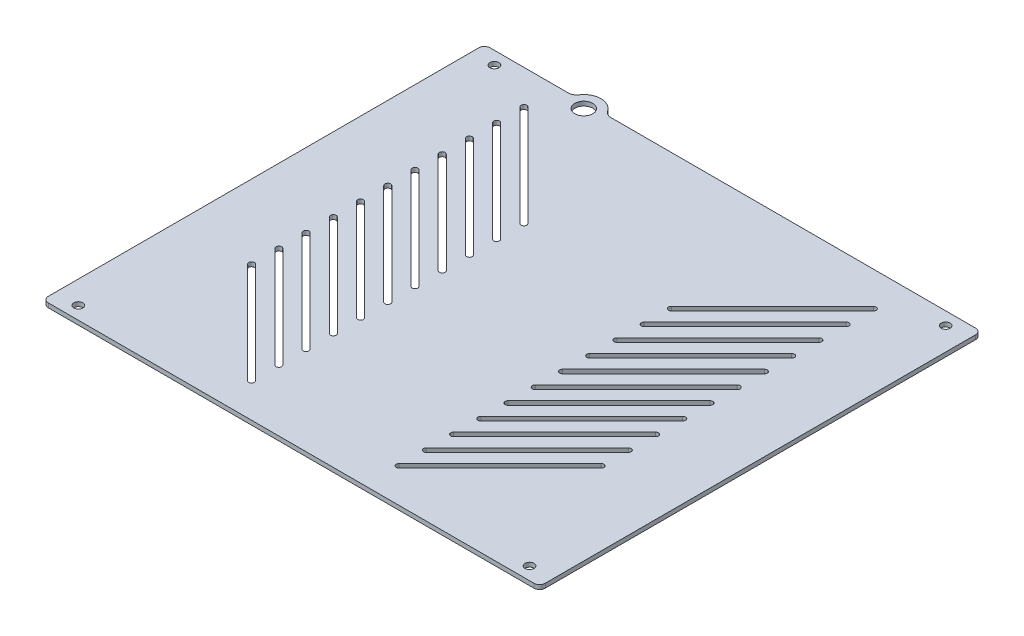
from build123d import *

# Parameters (mm, degrees)
SKETCH1_W          = 174
SKETCH1_H          = 154.7
SKETCH1_R          = 1.575
BASE_FLANGE1_DEPTH = 1.5
FILLET1_R          = 2
CUT_EXTRUDE1_DEPTH = 117.422817781
SKETCH7_R          = 6
TAB1_DEPTH         = 1.5
SKETCH10_R         = 3.15
CUT_EXTRUDE2_DEPTH = 120.117893282
FILLET2_R          = 3


# Sheet-metal steps are written as plain solids
with BuildPart() as part:
    # Sketch1 → Base-Flange1 (new body)
    with BuildSketch(Plane(origin=(0, 0, 0), x_dir=(1, 0, 0), z_dir=(0, 1, 0))):
        Rectangle(SKETCH1_W, SKETCH1_H)
        with Locations(Location((-79, 72.85, 0), (0, 0, 270))):
            Circle(SKETCH1_R, mode=Mode.SUBTRACT)
        with Locations(Location((79, 72.85, 0), (0, 0, 270))):
            Circle(SKETCH1_R, mode=Mode.SUBTRACT)
        with Locations(Location((79, -72.85, 0), (0, 0, 270))):
            Circle(SKETCH1_R, mode=Mode.SUBTRACT)
        with Locations(Location((-79, -72.85, 0), (0, 0, 270))):
            Circle(SKETCH1_R, mode=Mode.SUBTRACT)
    extrude(amount=-BASE_FLANGE1_DEPTH)

    # Fillet1
    fillet1_edges = [part.edges().sort_by_distance(p)[0] for p in [
        (-87, -0.75, -77.35),
        (87, -0.75, -77.35),
        (87, -0.75, 77.35),
        (-87, -0.75, 77.35),
    ]]
    fillet(fillet1_edges, radius=FILLET1_R)

    # Sketch6 → Cut-Extrude1 (cut, through all)
    with BuildSketch(Plane(origin=(0, 0, 0), x_dir=(1, 0, 0), z_dir=(0, 1, 0))):
        with BuildLine():
            Line((26.529437252, -66.057106781), (61.884776311, -30.701767722))
            ThreePointArc((61.884776311, -30.701767722), (61.884776311, -29.287554159), (60.470562748, -29.287554159))
            Line((60.470562748, -29.287554159), (25.115223689, -64.642893219))
            ThreePointArc((25.115223689, -64.642893219), (25.115223689, -66.057106781), (26.529437252, -66.057106781))
        make_face()
        with BuildLine():
            Line((26.529437252, -56.522640687), (61.884776311, -21.167301628))
            ThreePointArc((61.884776311, -21.167301628), (61.884776311, -19.753088065), (60.470562748, -19.753088065))
            Line((60.470562748, -19.753088065), (25.115223689, -55.108427125))
            ThreePointArc((25.115223689, -55.108427125), (25.115223689, -56.522640687), (26.529437252, -56.522640687))
        make_face()
        with BuildLine():
            Line((26.529437252, -46.988174593), (61.884776311, -11.632835534))
            ThreePointArc((61.884776311, -11.632835534), (61.884776311, -10.218621971), (60.470562748, -10.218621971))
            Line((60.470562748, -10.218621971), (25.115223689, -45.573961031))
            ThreePointArc((25.115223689, -45.573961031), (25.115223689, -46.988174593), (26.529437252, -46.988174593))
        make_face()
        with BuildLine():
            Line((26.529437252, -37.453708499), (61.884776311, -2.09836944))
            ThreePointArc((61.884776311, -2.09836944), (61.884776311, -0.684155877), (60.470562748, -0.684155877))
            Line((60.470562748, -0.684155877), (25.115223689, -36.039494937))
            ThreePointArc((25.115223689, -36.039494937), (25.115223689, -37.453708499), (26.529437252, -37.453708499))
        make_face()
        with BuildLine():
            Line((26.529437252, -27.919242405), (61.884776311, 7.436096654))
            ThreePointArc((61.884776311, 7.436096654), (61.884776311, 8.850310217), (60.470562748, 8.850310217))
            Line((60.470562748, 8.850310217), (25.115223689, -26.505028843))
            ThreePointArc((25.115223689, -26.505028843), (25.115223689, -27.919242405), (26.529437252, -27.919242405))
        make_face()
        with BuildLine():
            Line((26.529437252, -18.384776311), (61.884776311, 16.970562748))
            ThreePointArc((61.884776311, 16.970562748), (61.884776311, 18.384776311), (60.470562748, 18.384776311))
            Line((60.470562748, 18.384776311), (25.115223689, -16.970562748))
            ThreePointArc((25.115223689, -16.970562748), (25.115223689, -18.384776311), (26.529437252, -18.384776311))
        make_face()
        with BuildLine():
            Line((26.529437252, -8.850310217), (61.884776311, 26.505028843))
            ThreePointArc((61.884776311, 26.505028843), (61.884776311, 27.919242405), (60.470562748, 27.919242405))
            Line((60.470562748, 27.919242405), (25.115223689, -7.436096654))
            ThreePointArc((25.115223689, -7.436096654), (25.115223689, -8.850310217), (26.529437252, -8.850310217))
        make_face()
        with BuildLine():
            Line((26.529437252, 0.684155877), (61.884776311, 36.039494937))
            ThreePointArc((61.884776311, 36.039494937), (61.884776311, 37.453708499), (60.470562748, 37.453708499))
            Line((60.470562748, 37.453708499), (25.115223689, 2.09836944))
            ThreePointArc((25.115223689, 2.09836944), (25.115223689, 0.684155877), (26.529437252, 0.684155877))
        make_face()
        with BuildLine():
            Line((26.529437252, 10.218621971), (61.884776311, 45.573961031))
            ThreePointArc((61.884776311, 45.573961031), (61.884776311, 46.988174593), (60.470562748, 46.988174593))
            Line((60.470562748, 46.988174593), (25.115223689, 11.632835534))
            ThreePointArc((25.115223689, 11.632835534), (25.115223689, 10.218621971), (26.529437252, 10.218621971))
        make_face()
        with BuildLine():
            Line((26.529437252, 19.753088065), (61.884776311, 55.108427125))
            ThreePointArc((61.884776311, 55.108427125), (61.884776311, 56.522640687), (60.470562748, 56.522640687))
            Line((60.470562748, 56.522640687), (25.115223689, 21.167301628))
            ThreePointArc((25.115223689, 21.167301628), (25.115223689, 19.753088065), (26.529437252, 19.753088065))
        make_face()
        with BuildLine():
            Line((26.529437252, 29.287554159), (61.884776311, 64.642893219))
            ThreePointArc((61.884776311, 64.642893219), (61.884776311, 66.057106781), (60.470562748, 66.057106781))
            Line((60.470562748, 66.057106781), (25.115223689, 30.701767722))
            ThreePointArc((25.115223689, 30.701767722), (25.115223689, 29.287554159), (26.529437252, 29.287554159))
        make_face()
        with BuildLine():
            Line((-25.115223689, 30.701767722), (-60.470562748, 66.057106781))
            ThreePointArc((-60.470562748, 66.057106781), (-61.884776311, 66.057106781), (-61.884776311, 64.642893219))
            Line((-61.884776311, 64.642893219), (-26.529437252, 29.287554159))
            ThreePointArc((-26.529437252, 29.287554159), (-25.115223689, 29.287554159), (-25.115223689, 30.701767722))
        make_face()
        with BuildLine():
            Line((-25.115223689, 21.167301628), (-60.470562748, 56.522640687))
            ThreePointArc((-60.470562748, 56.522640687), (-61.884776311, 56.522640687), (-61.884776311, 55.108427125))
            Line((-61.884776311, 55.108427125), (-26.529437252, 19.753088065))
            ThreePointArc((-26.529437252, 19.753088065), (-25.115223689, 19.753088065), (-25.115223689, 21.167301628))
        make_face()
        with BuildLine():
            Line((-25.115223689, 11.632835534), (-60.470562748, 46.988174593))
            ThreePointArc((-60.470562748, 46.988174593), (-61.884776311, 46.988174593), (-61.884776311, 45.573961031))
            Line((-61.884776311, 45.573961031), (-26.529437252, 10.218621971))
            ThreePointArc((-26.529437252, 10.218621971), (-25.115223689, 10.218621971), (-25.115223689, 11.632835534))
        make_face()
        with BuildLine():
            Line((-25.115223689, 2.09836944), (-60.470562748, 37.453708499))
            ThreePointArc((-60.470562748, 37.453708499), (-61.884776311, 37.453708499), (-61.884776311, 36.039494937))
            Line((-61.884776311, 36.039494937), (-26.529437252, 0.684155877))
            ThreePointArc((-26.529437252, 0.684155877), (-25.115223689, 0.684155877), (-25.115223689, 2.09836944))
        make_face()
        with BuildLine():
            Line((-25.115223689, -7.436096654), (-60.470562748, 27.919242405))
            ThreePointArc((-60.470562748, 27.919242405), (-61.884776311, 27.919242405), (-61.884776311, 26.505028843))
            Line((-61.884776311, 26.505028843), (-26.529437252, -8.850310217))
            ThreePointArc((-26.529437252, -8.850310217), (-25.115223689, -8.850310217), (-25.115223689, -7.436096654))
        make_face()
        with BuildLine():
            Line((-25.115223689, -16.970562748), (-60.470562748, 18.384776311))
            ThreePointArc((-60.470562748, 18.384776311), (-61.884776311, 18.384776311), (-61.884776311, 16.970562748))
            Line((-61.884776311, 16.970562748), (-26.529437252, -18.384776311))
            ThreePointArc((-26.529437252, -18.384776311), (-25.115223689, -18.384776311), (-25.115223689, -16.970562748))
        make_face()
        with BuildLine():
            Line((-25.115223689, -26.505028843), (-60.470562748, 8.850310217))
            ThreePointArc((-60.470562748, 8.850310217), (-61.884776311, 8.850310217), (-61.884776311, 7.436096654))
            Line((-61.884776311, 7.436096654), (-26.529437252, -27.919242405))
            ThreePointArc((-26.529437252, -27.919242405), (-25.115223689, -27.919242405), (-25.115223689, -26.505028843))
        make_face()
        with BuildLine():
            Line((-25.115223689, -36.039494937), (-60.470562748, -0.684155877))
            ThreePointArc((-60.470562748, -0.684155877), (-61.884776311, -0.684155877), (-61.884776311, -2.09836944))
            Line((-61.884776311, -2.09836944), (-26.529437252, -37.453708499))
            ThreePointArc((-26.529437252, -37.453708499), (-25.115223689, -37.453708499), (-25.115223689, -36.039494937))
        make_face()
        with BuildLine():
            Line((-25.115223689, -45.573961031), (-60.470562748, -10.218621971))
            ThreePointArc((-60.470562748, -10.218621971), (-61.884776311, -10.218621971), (-61.884776311, -11.632835534))
            Line((-61.884776311, -11.632835534), (-26.529437252, -46.988174593))
            ThreePointArc((-26.529437252, -46.988174593), (-25.115223689, -46.988174593), (-25.115223689, -45.573961031))
        make_face()
        with BuildLine():
            Line((-25.115223689, -55.108427125), (-60.470562748, -19.753088065))
            ThreePointArc((-60.470562748, -19.753088065), (-61.884776311, -19.753088065), (-61.884776311, -21.167301628))
            Line((-61.884776311, -21.167301628), (-26.529437252, -56.522640687))
            ThreePointArc((-26.529437252, -56.522640687), (-25.115223689, -56.522640687), (-25.115223689, -55.108427125))
        make_face()
        with BuildLine():
            Line((-25.115223689, -64.642893219), (-60.470562748, -29.287554159))
            ThreePointArc((-60.470562748, -29.287554159), (-61.884776311, -29.287554159), (-61.884776311, -30.701767722))
            Line((-61.884776311, -30.701767722), (-26.529437252, -66.057106781))
            ThreePointArc((-26.529437252, -66.057106781), (-25.115223689, -66.057106781), (-25.115223689, -64.642893219))
        make_face()
    extrude(amount=-CUT_EXTRUDE1_DEPTH, mode=Mode.SUBTRACT)

    # Sketch7 → Tab1 (add)
    with BuildSketch(Plane(origin=(0, 0, 0), x_dir=(1, 0, 0), z_dir=(0, 1, 0))):
        with Locations((-50.194998341, 75.35)):
            Circle(SKETCH7_R)
    extrude(amount=-TAB1_DEPTH)

    # Sketch10 → Cut-Extrude2 (cut, through all)
    with BuildSketch(Plane(origin=(0, 0, 0), x_dir=(1, 0, 0), z_dir=(0, 1, 0))):
        with Locations(Location((-50.194998341, 75.35, 0), (0, 0, 270))):
            Circle(SKETCH10_R)
    extrude(amount=-CUT_EXTRUDE2_DEPTH, mode=Mode.SUBTRACT)

    # Fillet2
    fillet2_edges = [part.edges().sort_by_distance(p)[0] for p in [
        (-55.85185259, -0.75, -77.35),
        (-44.538144091, -0.75, -77.35),
    ]]
    fillet(fillet2_edges, radius=FILLET2_R)


solid = part.part
